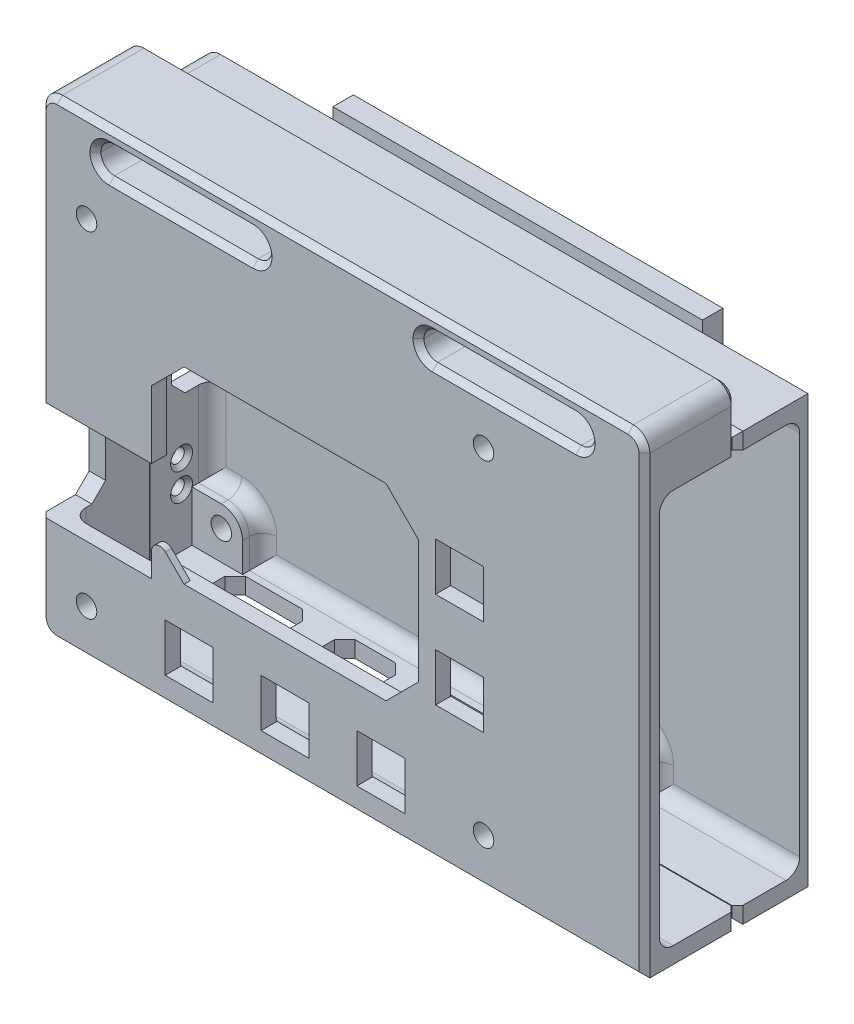
from build123d import *

# Parameters (mm, degrees)
BOSS_EXTRUDE1_DEPTH      = 13.1275
BOSS_EXTRUDE2_DEPTH      = 0.4
BOSS_EXTRUDE2_DEPTH_BACK = 1.8
CUT_EXTRUDE1_DEPTH       = 105.17063693767074
CUT_EXTRUDE2_DEPTH       = 1.3
SKETCH15_W               = 39
SKETCH15_H               = 3.999999999999993
SKETCH15_W_2             = 11
SKETCH15_H_2             = 4
CUT_EXTRUDE8_DEPTH       = 1
SKETCH5_R                = 1.500000000000004
SKETCH5_R_2              = 1.5000000000000002
SKETCH5_R_3              = 1.5000000000000004
SKETCH5_R_4              = 1.5000000000000042
BOSS_EXTRUDE3_DEPTH      = 2.8875
SKETCH17_R               = 1.5000000000000007
SKETCH17_R_2             = 1.5000000000000009
SKETCH17_R_3             = 1.5000000000000109
SKETCH17_R_4             = 1.500000000000004
CUT_EXTRUDE9_DEPTH       = 105.20149833975519
SKETCH6_W                = 7.000000000000007
SKETCH6_H                = 7
SKETCH6_W_2              = 7
SKETCH6_H_2              = 6.999999999999999
CUT_EXTRUDE3_DEPTH       = 105.46354989301294
CUT_EXTRUDE4_DEPTH       = 7.0875
BOSS_EXTRUDE4_DEPTH      = 9.16
SKETCH9_R                = 1.5000000000000009
SKETCH9_R_2              = 1.5000000000000109
SKETCH9_R_3              = 1.500000000000004
SKETCH9_R_4              = 1.5000000000000007
BOSS_EXTRUDE5_DEPTH      = 2
SKETCH10_R               = 1.5000000000000044
SKETCH10_R_2             = 1.5000000000000007
SKETCH10_R_3             = 1.5000000000000042
SKETCH10_R_4             = 1.5000000000000018
BOSS_EXTRUDE6_DEPTH      = 3
SKETCH11_W               = 8.846984852238524
SKETCH11_H               = 17.999999999999996
CUT_EXTRUDE5_DEPTH       = 8
CUT_EXTRUDE6_DEPTH       = 2.4
CHAMFER1_SIZE            = 1.5
FILLET1_R                = 2
FILLET2_R                = 2
CUT_EXTRUDE7_DEPTH       = 108.08866726339443
BOSS_EXTRUDE7_DEPTH      = 13.4775
SKETCH21_R               = 1.000000000000001
SKETCH21_R_2             = 1.0000000000000004
CUT_EXTRUDE11_DEPTH      = 4
CHAMFER10_SIZE           = 0.6
CHAMFER7_SIZE            = 0.8
FILLET3_R                = 2
FILLET4_R                = 2.4
FILLET5_R                = 2.4
CHAMFER2_SIZE            = 0.8
CHAMFER3_SIZE            = 0.8
FILLET6_R                = 1.2
CHAMFER5_SIZE            = 2
CHAMFER6_SIZE            = 2
SKETCH18_W               = 54.00000000000004
SKETCH18_H               = 64.00000000000001
BOSS_EXTRUDE8_DEPTH      = 3
SKETCH20_R               = 1.3000000000000023
SKETCH20_R_2             = 1.3000000000000016
SKETCH20_R_3             = 3.9999999999999982
CUT_EXTRUDE10_DEPTH      = 111.8826300925894
CHAMFER8_SIZE            = 0.8
CHAMFER9_SIZE            = 0.8
FILLET7_R                = 3


# Some blends are built 0.0001 mm under size
with BuildPart() as part:
    # Sketch2 → Boss-Extrude1 (new body)
    with BuildSketch(Plane.XY.offset(18.287499999999998)):
        Polygon((84.99999999999999, 56.800000000000004), (85.00000000000001, 59.2), (-3.200000000000008, 59.19999999999999), (-3.1999999999999895, -3.1999999999999877), (85.00000000000001, -3.199999999999939), (85, -0.7999999999999952), (-0.7999999999999813, -0.7999999999999883), (-0.7999999999999813, 56.8), align=None)
    extrude(amount=-BOSS_EXTRUDE1_DEPTH)

    # Sketch3 → Boss-Extrude2 (add, two sides: drawn at the far end of the back side and taken through both)
    with BuildSketch(Plane.XY.offset(18.287499999999998).offset(-BOSS_EXTRUDE2_DEPTH_BACK)):
        Polygon((85.00000000000001, -3.199999999999939), (-3.2000000000000006, -3.199999999999939), (-3.200000000000008, 59.19999999999999), (85.00000000000001, 59.2), align=None)
    extrude(amount=BOSS_EXTRUDE2_DEPTH + BOSS_EXTRUDE2_DEPTH_BACK)

    # Sketch1 → Cut-Extrude1 (cut, through all)
    with BuildSketch(Plane.XY.offset(16.200000000000003)):
        Polygon((13.000000000000007, 36.14999999999996), (17.750000000000046, 40.900000000000006), (47.249999999999986, 40.900000000000006), (52.00000000000003, 36.14999999999997), (52.00000000000003, 18.15000000000005), (47.249999999999986, 13.40000000000001), (17.750000000000046, 13.40000000000001), (13.000000000000005, 18.15000000000004), align=None)
    extrude(amount=CUT_EXTRUDE1_DEPTH, mode=Mode.SUBTRACT)

    # Sketch4 → Cut-Extrude2 (cut)
    with BuildSketch(Plane(origin=(0, 0, 16.487499999999997), x_dir=(-1, 0, 0), z_dir=(0, 0, -1))):
        Polygon((-13.000000000000009, 40.900000000000006), (-52.00000000000002, 40.900000000000006), (-52.00000000000003, 13.400000000000002), (-13.000000000000005, 13.400000000000002), align=None)
    extrude(amount=-CUT_EXTRUDE2_DEPTH, mode=Mode.SUBTRACT)

    # Sketch15 → Cut-Extrude8 (cut)
    with BuildSketch(Plane(origin=(0, 0, 16.487499999999997), x_dir=(-1, 0, 0), z_dir=(0, 0, -1))):
        with Locations((-32.50000000000001, 47.89999999999995)):
            Rectangle(SKETCH15_W, SKETCH15_H)
        with Locations((-46.50000000000001, 10.099999999999937)):
            Rectangle(SKETCH15_W_2, SKETCH15_H_2)
        Polygon((-24.000000000000004, 12.099999999999937), (-13.00000000000001, 12.099999999999989), (-13.00000000000001, 8.099999999999937), (-24.000000000000004, 8.099999999999941), align=None)
    extrude(amount=-CUT_EXTRUDE8_DEPTH, mode=Mode.SUBTRACT)

    # Sketch5 → Boss-Extrude3 (add)
    # profile 1 of 4: a face of its own
    with BuildSketch(Plane(origin=(0, 0, 16.487499999999997), x_dir=(-1, 0, 0), z_dir=(0, 0, -1))):
        with BuildLine():
            Line((-52.815937956643374, -0.7999999999999952), (-64.6, -0.7999999999999967))
            Line((-64.6, -0.7999999999999967), (-64.59999999999998, 3.4999999999999614))
            ThreePointArc((-64.59999999999998, 3.4999999999999614), (-62.686318640331784, 6.3640265507849225), (-59.30796897832172, 5.692031021678271))
            Line((-59.30796897832172, 5.692031021678271), (-52.815937956643374, -0.7999999999999952))
        make_face()
        with Locations(Location((-61.50000000000001, 3.4999999999999614, 0), (0, 0, 90))):
            Circle(SKETCH5_R, mode=Mode.SUBTRACT)
    # profile 2 of 4: a face of its own
    with BuildSketch(Plane(origin=(0, 0, 16.487499999999997), x_dir=(-1, 0, 0), z_dir=(0, 0, -1))):
        with BuildLine():
            Line((-6.599999999999987, 3.499999999999961), (-6.599999999999987, -0.7999999999999952))
            Line((-6.599999999999987, -0.7999999999999952), (0.7999999999999813, -0.7999999999999883))
            Line((0.7999999999999813, -0.7999999999999883), (0.7999999999999803, 6.599999999999961))
            Line((0.7999999999999803, 6.599999999999961), (-3.4999999999999893, 6.599999999999961))
            ThreePointArc((-3.4999999999999893, 6.599999999999961), (-5.692031021678284, 5.692031021678252), (-6.599999999999987, 3.499999999999961))
        make_face()
        with Locations(Location((-3.500000000000003, 3.4999999999999614, 0), (0, 0, 90))):
            Circle(SKETCH5_R_2, mode=Mode.SUBTRACT)
    # profile 3 of 4: a face of its own
    with BuildSketch(Plane(origin=(0, 0, 16.487499999999997), x_dir=(-1, 0, 0), z_dir=(0, 0, -1))):
        with BuildLine():
            Line((0.7999999999999803, 49.39999999999996), (0.7999999999999813, 56.79999999999991))
            Line((0.7999999999999813, 56.79999999999991), (-6.599999999999987, 56.79999999999992))
            Line((-6.599999999999987, 56.79999999999992), (-6.599999999999987, 52.499999999999964))
            ThreePointArc((-6.599999999999987, 52.499999999999964), (-5.692031021678284, 50.307968978321675), (-3.4999999999999893, 49.39999999999996))
            Line((-3.4999999999999893, 49.39999999999996), (0.7999999999999803, 49.39999999999996))
        make_face()
        with Locations(Location((-3.500000000000003, 52.499999999999964, 0), (0, 0, 180))):
            Circle(SKETCH5_R_3, mode=Mode.SUBTRACT)
    # profile 4 of 4: a face of its own
    with BuildSketch(Plane(origin=(0, 0, 16.487499999999997), x_dir=(-1, 0, 0), z_dir=(0, 0, -1))):
        with BuildLine():
            Line((-59.30796897832171, 50.307968978321654), (-52.815937956643374, 56.79999999999992))
            Line((-52.815937956643374, 56.79999999999992), (-64.6, 56.79999999999992))
            Line((-64.6, 56.79999999999992), (-64.59999999999998, 52.499999999999964))
            ThreePointArc((-64.59999999999998, 52.499999999999964), (-62.68631864033178, 49.635973449215), (-59.30796897832171, 50.307968978321654))
        make_face()
        with Locations(Location((-61.50000000000001, 52.499999999999964, 0), (0, 0, 180))):
            Circle(SKETCH5_R_4, mode=Mode.SUBTRACT)
    extrude(amount=BOSS_EXTRUDE3_DEPTH)

    # Sketch17 → Cut-Extrude9 (cut, through all)
    with BuildSketch(Plane(origin=(0, 0, 16.487499999999997), x_dir=(-1, 0, 0), z_dir=(0, 0, -1))):
        with Locations(Location((-3.500000000000003, 3.4999999999999614, 0), (0, 0, 90))):
            Circle(SKETCH17_R)
        with Locations(Location((-3.500000000000003, 52.499999999999964, 0), (0, 0, 90))):
            Circle(SKETCH17_R_2)
        with Locations(Location((-61.50000000000001, 52.499999999999964, 0), (0, 0, 90))):
            Circle(SKETCH17_R_3)
        with Locations(Location((-61.50000000000001, 3.4999999999999614, 0), (0, 0, 90))):
            Circle(SKETCH17_R_4)
    extrude(amount=-CUT_EXTRUDE9_DEPTH, mode=Mode.SUBTRACT)

    # Sketch6 → Cut-Extrude3 (cut, through all)
    with BuildSketch(Plane.XY.offset(18.6875)):
        with Locations((58.000000000000014, 19.999999999999957)):
            Rectangle(SKETCH6_W, SKETCH6_H)
        with Locations((58.00000000000001, 33.99999999999996)):
            Rectangle(SKETCH6_W_2, SKETCH6_H)
        with Locations((18.50000000000001, 3.999999999999955)):
            Rectangle(SKETCH6_W_2, SKETCH6_H_2)
        with Locations((46.5, 3.999999999999955)):
            Rectangle(SKETCH6_W, SKETCH6_H_2)
        with Locations((32.500000000000014, 3.999999999999955)):
            Rectangle(SKETCH6_W, SKETCH6_H_2)
    extrude(amount=-CUT_EXTRUDE3_DEPTH, mode=Mode.SUBTRACT)

    # Sketch7 → Cut-Extrude4 (cut)
    with BuildSketch(Plane.XY.offset(18.6875)):
        Polygon((-3.200000000000005, 11.71499999999995), (12.999999999999998, 11.714999999999952), (12.999999999999998, 26.284999999999958), (-3.200000000000008, 26.284999999999954), align=None)
    extrude(amount=-CUT_EXTRUDE4_DEPTH, mode=Mode.SUBTRACT)


with BuildPart() as body_2:
    # Sketch8 → Boss-Extrude4 (new body)
    with BuildSketch(Plane(origin=(0, 0, 5.159999999999999), x_dir=(-1, 0, 0), z_dir=(0, 0, -1))):
        Polygon((-85.00000000000001, 59.2), (-84.99999999999999, 56.800000000000004), (0.7999999999999813, 56.8), (0.7999999999999813, -0.7999999999999883), (-85, -0.7999999999999952), (-85.00000000000001, -3.199999999999939), (3.1999999999999895, -3.1999999999999877), (3.200000000000008, 59.19999999999999), align=None)
    extrude(amount=BOSS_EXTRUDE4_DEPTH)

    # Sketch9 → Boss-Extrude5 (add)
    with BuildSketch(Plane(origin=(0, 0, -4), x_dir=(-1, 0, 0), z_dir=(0, 0, -1))):
        Polygon((-85.00000000000001, -3.199999999999939), (3.2000000000000006, -3.199999999999939), (3.200000000000008, 59.19999999999999), (-85.00000000000001, 59.2), align=None)
        with Locations((-3.500000000000003, 52.499999999999964)):
            Circle(SKETCH9_R, mode=Mode.SUBTRACT)
        with Locations((-61.50000000000001, 52.499999999999964)):
            Circle(SKETCH9_R_2, mode=Mode.SUBTRACT)
        with Locations((-61.50000000000001, 3.4999999999999614)):
            Circle(SKETCH9_R_3, mode=Mode.SUBTRACT)
        with Locations((-3.500000000000003, 3.4999999999999614)):
            Circle(SKETCH9_R_4, mode=Mode.SUBTRACT)
    extrude(amount=BOSS_EXTRUDE5_DEPTH)

    # Sketch10 → Boss-Extrude6 (add)
    # profile 1 of 4: a face of its own
    with BuildSketch(Plane.XY.offset(-4)):
        with BuildLine():
            Line((52.815937956643374, -0.7999999999999952), (64.6, -0.7999999999999967))
            Line((64.6, -0.7999999999999967), (64.59999999999998, 3.4999999999999614))
            ThreePointArc((64.59999999999998, 3.4999999999999614), (62.686318640331784, 6.364026550784922), (59.30796897832174, 5.692031021678257))
            Line((59.30796897832174, 5.692031021678257), (52.815937956643374, -0.7999999999999952))
        make_face()
        with Locations((61.50000000000001, 3.4999999999999614)):
            Circle(SKETCH10_R, mode=Mode.SUBTRACT)
    # profile 2 of 4: a face of its own
    with BuildSketch(Plane.XY.offset(-4)):
        with BuildLine():
            Line((-0.7999999999999813, -0.7999999999999883), (6.599999999999987, -0.7999999999999952))
            Line((6.599999999999987, -0.7999999999999952), (6.599999999999998, 3.4999999999999614))
            ThreePointArc((6.599999999999998, 3.4999999999999614), (5.692031021678292, 5.69203102167826), (3.49999999999999, 6.599999999999957))
            Line((3.49999999999999, 6.599999999999957), (-0.7999999999999803, 6.599999999999961))
            Line((-0.7999999999999803, 6.599999999999961), (-0.7999999999999813, -0.7999999999999883))
        make_face()
        with Locations((3.500000000000003, 3.4999999999999614)):
            Circle(SKETCH10_R_2, mode=Mode.SUBTRACT)
    # profile 3 of 4: a face of its own
    with BuildSketch(Plane.XY.offset(-4)):
        with BuildLine():
            Line((52.815937956643374, 56.79999999999992), (59.30796897832171, 50.307968978321654))
            ThreePointArc((59.30796897832171, 50.307968978321654), (62.68631864033179, 49.63597344921497), (64.59999999999998, 52.499999999999964))
            Line((64.59999999999998, 52.499999999999964), (64.6, 56.79999999999992))
            Line((64.6, 56.79999999999992), (52.815937956643374, 56.79999999999992))
        make_face()
        with Locations((61.50000000000001, 52.499999999999964)):
            Circle(SKETCH10_R_3, mode=Mode.SUBTRACT)
    # profile 4 of 4: a face of its own
    with BuildSketch(Plane.XY.offset(-4)):
        with BuildLine():
            Line((-0.7999999999999813, 56.79999999999991), (-0.7999999999999803, 49.39999999999996))
            Line((-0.7999999999999803, 49.39999999999996), (3.499999999999989, 49.39999999999998))
            ThreePointArc((3.499999999999989, 49.39999999999998), (5.692031021678286, 50.30796897832167), (6.599999999999987, 52.499999999999964))
            Line((6.599999999999987, 52.499999999999964), (6.599999999999987, 56.79999999999992))
            Line((6.599999999999987, 56.79999999999992), (-0.7999999999999813, 56.79999999999991))
        make_face()
        with Locations((3.500000000000003, 52.499999999999964)):
            Circle(SKETCH10_R_4, mode=Mode.SUBTRACT)
    extrude(amount=BOSS_EXTRUDE6_DEPTH)

    # Sketch11 → Cut-Extrude5 (cut)
    with BuildSketch(Plane(origin=(0, 0, -6), x_dir=(-1, 0, 0), z_dir=(0, 0, -1))):
        with Locations((-1.2234924261192555, 28.000000000000036)):
            Rectangle(SKETCH11_W, SKETCH11_H)
    extrude(amount=-CUT_EXTRUDE5_DEPTH, mode=Mode.SUBTRACT)


with BuildPart() as cut_extrude6_tool:
    # Sketch12 → Cut-Extrude6 (new body)
    with BuildSketch(Plane.XZ.offset(3.199999999999986)):
        with BuildLine():
            Line((49.99999999999999, 2.9), (49.99999999999999, 5.159999999999998))
            Line((49.99999999999999, 5.159999999999998), (50.69963638366921, 5.159999999999998))
            ThreePointArc((50.69963638366921, 5.159999999999998), (54, 6.900000000000002), (57.300363616330785, 5.159999999999998))
            Line((57.300363616330785, 5.159999999999998), (58, 5.159999999999998))
            Line((58, 5.159999999999998), (58, 2.9))
            ThreePointArc((58, 2.9), (54, -1.100000000000009), (49.99999999999999, 2.9))
        make_face()
        Polygon((21.55, -1), (30.469999782791994, -0.9999999999999989), (30.469999782791994, 5.159999999999997), (21.55, 5.159999999999996), align=None)
        Polygon((35.050000000000004, -1), (43.969999782792, -0.9999999999999989), (43.969999782792, 5.159999999999997), (35.050000000000004, 5.159999999999996), align=None)
        Polygon((5.530000000000009, -1.0000000000000013), (16.87, -1), (16.87, 5.159999999999998), (5.530000000000007, 5.159999999999997), align=None)
    extrude(amount=-CUT_EXTRUDE6_DEPTH)


with BuildPart() as part_1:
    add(part.part)

    # Cut-Extrude6: cut by cut_extrude6_tool
    add(cut_extrude6_tool.part, mode=Mode.SUBTRACT)

    # Fillet2
    # the kernel refuses this fillet: 2 mm, written as the material it adds along each edge
    with BuildSketch(Plane(origin=(64.6, 56.79999999999992, 16.487499999999997), x_dir=(0, 0, -1), z_dir=(-3.3e-15, -1, 0))) as fillet2_piece_1:
        with BuildLine():
            CenterArc((FILLET2_R, FILLET2_R), FILLET2_R, 180, 90)
            Line((0, FILLET2_R), (0, 0))
            Line((0, 0), (FILLET2_R, 0))
        make_face()
    extrude(amount=4.2999999999999545)
    with BuildSketch(Plane(origin=(59.30796897832171, 50.307968978321654, 16.487499999999997), x_dir=(0, 0, -1), z_dir=(-0.7071067811865515, 0.7071067811865437, 0))) as fillet2_piece_2_section:
        with BuildLine():
            CenterArc((FILLET2_R, FILLET2_R), FILLET2_R, 180.00000000000014, 89.99999999999989)
            Line((0, FILLET2_R), (0, 0))
            Line((0, 0), (FILLET2_R, 0))
        make_face()
    fillet2_piece_2 = extrude(amount=14.181118318204316, mode=Mode.PRIVATE)
    fillet2_piece_2 = split(fillet2_piece_2, bisect_by=Plane(origin=(55.57262538274945, 56.800000000000004, 16.049357236234062), z_dir=(8e-17, -1, 0)), keep=Keep.TOP, mode=Mode.PRIVATE)
    add(fillet2_piece_2)
    with BuildSketch(Plane(origin=(6.599999999999987, 56.79999999999992, 16.487499999999997), x_dir=(0, 0, -1), z_dir=(0, -1, 0))) as fillet2_piece_3:
        with BuildLine():
            CenterArc((FILLET2_R, FILLET2_R), FILLET2_R, 180, 90)
            Line((0, FILLET2_R), (0, 0))
            Line((0, 0), (FILLET2_R, 0))
        make_face()
    extrude(amount=4.2999999999999545)
    with BuildSketch(Plane(origin=(3.4999999999999893, 49.39999999999996, 16.487499999999997), x_dir=(0, 0, -1), z_dir=(-1, 0, 0))) as fillet2_piece_4:
        with BuildLine():
            CenterArc((FILLET2_R, FILLET2_R), FILLET2_R, 180, 90)
            Line((0, FILLET2_R), (0, 0))
            Line((0, 0), (FILLET2_R, 0))
        make_face()
    extrude(amount=4.29999999999997)
    with BuildSketch(Plane(origin=(-0.7999999999999803, 6.599999999999961, 16.487499999999997), x_dir=(0, 0, -1), z_dir=(1, 0, 0))) as fillet2_piece_5:
        with BuildLine():
            CenterArc((FILLET2_R, FILLET2_R), FILLET2_R, 179.99999999999994, 90.00000000000006)
            Line((0, FILLET2_R), (0, 0))
            Line((0, 0), (FILLET2_R, 0))
        make_face()
    extrude(amount=4.29999999999997)
    with BuildSketch(Plane(origin=(6.599999999999987, 3.499999999999961, 16.487499999999997), x_dir=(0, 0, -1), z_dir=(0, -1, 0))) as fillet2_piece_6_section:
        with BuildLine():
            CenterArc((FILLET2_R, FILLET2_R), FILLET2_R, 180, 90)
            Line((0, FILLET2_R), (0, 0))
            Line((0, 0), (FILLET2_R, 0))
        make_face()
    fillet2_piece_6 = extrude(amount=9.299999999999956, mode=Mode.PRIVATE)
    fillet2_piece_6 = split(fillet2_piece_6, bisect_by=Plane(origin=(7.046735877891493, -3.199999999999939, 16.04076412210849), z_dir=(0, 1, 0)), keep=Keep.TOP, mode=Mode.PRIVATE)
    add(fillet2_piece_6)
    with BuildSketch(Plane(origin=(59.30796897832172, 5.692031021678271, 16.487499999999997), x_dir=(-0.7071067811865434, 0.7071067811865518, 0), z_dir=(-0.7071067811865517, -0.7071067811865434, 0))) as fillet2_piece_7_section:
        with BuildLine():
            CenterArc((FILLET2_R, FILLET2_R), FILLET2_R, 180, 90)
            Line((-6.3e-16, FILLET2_R), (0, 0))
            Line((0, 0), (FILLET2_R, 0))
        make_face()
    fillet2_piece_7 = extrude(amount=14.18111831820432, mode=Mode.PRIVATE)
    fillet2_piece_7 = split(fillet2_piece_7, bisect_by=Plane(origin=(55.57262538274922, -3.199999999999939, 16.04935723623407), z_dir=(0, 1, 0)), keep=Keep.TOP, mode=Mode.PRIVATE)
    add(fillet2_piece_7)
    with BuildSketch(Plane(origin=(64.60000000000001, -5.800000000000001, 16.487499999999997), x_dir=(1, 3.3e-15, 0), z_dir=(-3.3e-15, 1, 0))) as fillet2_piece_8_section:
        with BuildLine():
            CenterArc((FILLET2_R, FILLET2_R), FILLET2_R, 180, 90)
            Line((0, FILLET2_R), (0, 0))
            Line((0, 0), (FILLET2_R, 0))
        make_face()
    fillet2_piece_8 = extrude(amount=9.299999999999958, mode=Mode.PRIVATE)
    fillet2_piece_8 = split(fillet2_piece_8, bisect_by=Plane(origin=(65.0467358778915, -3.199999999999939, 16.040764122108495), z_dir=(0, 1, 0)), keep=Keep.TOP, mode=Mode.PRIVATE)
    add(fillet2_piece_8)
    with BuildSketch(Plane(origin=(1.5999999999999872, 56.8, 16.487499999999997), x_dir=(0, 0, -1), z_dir=(1, 8e-17, 0))) as fillet2_piece_9:
        with BuildLine():
            CenterArc((FILLET2_R, -FILLET2_R), FILLET2_R, 90, 90)
            Line((0, -FILLET2_R), (0, 0))
            Line((0, 0), (FILLET2_R, 0))
        make_face()
    extrude(amount=56.21593795664339)
    with BuildSketch(Plane(origin=(59.599999999999994, 56.800000000000004, 16.487499999999997), x_dir=(0, 0, -1), z_dir=(1, 8e-17, 0))) as fillet2_piece_10:
        with BuildLine():
            CenterArc((FILLET2_R, -FILLET2_R), FILLET2_R, 90, 90)
            Line((0, -FILLET2_R), (0, 0))
            Line((0, 0), (FILLET2_R, 0))
        make_face()
    extrude(amount=25.39999999999999)
    with BuildSketch(Plane(origin=(61.49999999999998, 52.49999999999998, 16.487499999999997), x_dir=(1, -4.58e-15, 0), z_dir=(4.58e-15, 1, 0))) as fillet2_piece_11:
        with BuildLine():
            CenterArc((3.1000000000000014 + FILLET2_R, FILLET2_R), FILLET2_R, 180, 90)
            Line((3.1000000000000014 + FILLET2_R, 0), (3.1000000000000014, 0))
            Line((3.1000000000000014, 0), (3.1000000000000014, FILLET2_R))
        make_face()
    revolve(axis=Axis((61.49999999999998, 52.49999999999998, 16.487499999999997), (0, 0, -1)), revolution_arc=134.999999999999)
    with BuildSketch(Plane(origin=(3.4999999999999725, 52.49999999999998, 16.487499999999997), x_dir=(1, -4.58e-15, 0), z_dir=(4.58e-15, 1, 0))) as fillet2_piece_12:
        with BuildLine():
            CenterArc((3.1000000000000147 + FILLET2_R, FILLET2_R), FILLET2_R, 180, 90)
            Line((3.1000000000000147 + FILLET2_R, 0), (3.1000000000000147, 0))
            Line((3.1000000000000147, 0), (3.1000000000000147, FILLET2_R))
        make_face()
    revolve(axis=Axis((3.4999999999999725, 52.49999999999998, 16.487499999999997), (0, 0, -1)), revolution_arc=89.99999999999943)
    with BuildSketch(Plane(origin=(-0.7999999999999821, 26.284999999999954, 16.487499999999997), x_dir=(4.4e-16, 0, -1), z_dir=(0, 1, 0))) as fillet2_piece_13:
        with BuildLine():
            CenterArc((FILLET2_R, -FILLET2_R), FILLET2_R, 90.00000000000003, 89.99999999999994)
            Line((8.9e-16, -FILLET2_R), (0, 0))
            Line((0, 0), (FILLET2_R, 0))
        make_face()
    extrude(amount=28.11500000000001)
    with BuildSketch(Plane(origin=(-0.7999999999999813, 1.5999999999999606, 16.487499999999997), x_dir=(6e-17, 0, -1), z_dir=(0, 1, 0))) as fillet2_piece_14:
        with BuildLine():
            CenterArc((FILLET2_R, -FILLET2_R), FILLET2_R, 90, 89.99999999999994)
            Line((1.1e-16, -FILLET2_R), (0, 0))
            Line((0, 0), (FILLET2_R, 0))
        make_face()
    extrude(amount=10.11499999999999)
    with BuildSketch(Plane(origin=(3.4999999999999774, 3.4999999999999507, 16.487499999999997), x_dir=(3.87e-15, 1, 0), z_dir=(-1, 3.87e-15, 0))) as fillet2_piece_15:
        with BuildLine():
            CenterArc((3.10000000000001 + FILLET2_R, FILLET2_R), FILLET2_R, 180, 90.00000000000006)
            Line((3.10000000000001 + FILLET2_R, 0), (3.10000000000001, 0))
            Line((3.10000000000001, 0), (3.10000000000001, FILLET2_R))
        make_face()
    revolve(axis=Axis((3.4999999999999774, 3.4999999999999507, 16.487499999999997), (0, 0, -1)), revolution_arc=89.99999999999959)
    with BuildSketch(Plane(origin=(85, -0.7999999999999962, 16.487499999999997), x_dir=(8e-17, 1, 0), z_dir=(-1, 8e-17, 0))) as fillet2_piece_16:
        with BuildLine():
            CenterArc((FILLET2_R, FILLET2_R), FILLET2_R, 180, 90)
            Line((-1e-15, FILLET2_R), (0, 0))
            Line((0, 0), (FILLET2_R, 0))
        make_face()
    extrude(amount=25.400000000000006)
    with BuildSketch(Plane(origin=(57.81593795664338, -0.7999999999999936, 16.487499999999997), x_dir=(8e-17, 1, 0), z_dir=(-1, 8e-17, 0))) as fillet2_piece_17_section:
        with BuildLine():
            CenterArc((FILLET2_R, FILLET2_R), FILLET2_R, 180, 90)
            Line((0, FILLET2_R), (0, 0))
            Line((0, 0), (FILLET2_R, 0))
        make_face()
    fillet2_piece_17 = extrude(amount=56.21593795664339, mode=Mode.PRIVATE)
    fillet2_piece_17 = split(fillet2_piece_17, bisect_by=Plane(origin=(50.00000000000001, 0.6781341143220752, 16.450279888444182), z_dir=(1, 0, 0)), keep=Keep.TOP, mode=Mode.PRIVATE)
    add(fillet2_piece_17)
    with BuildSketch(Plane(origin=(57.81593795664338, -0.7999999999999936, 16.487499999999997), x_dir=(8e-17, 1, 0), z_dir=(-1, 8e-17, 0))) as fillet2_piece_18_section:
        with BuildLine():
            CenterArc((FILLET2_R, FILLET2_R), FILLET2_R, 180, 90)
            Line((0, FILLET2_R), (0, 0))
            Line((0, 0), (FILLET2_R, 0))
        make_face()
    fillet2_piece_18 = extrude(amount=56.21593795664339, mode=Mode.PRIVATE)
    fillet2_piece_18 = split(fillet2_piece_18, bisect_by=Plane(origin=(46.500000000000014, 0.49999999999995576, 16.026395634018595), z_dir=(0, -1, 0)), keep=Keep.TOP, mode=Mode.PRIVATE)
    add(fillet2_piece_18)
    with BuildSketch(Plane(origin=(57.81593795664338, -0.7999999999999936, 16.487499999999997), x_dir=(8e-17, 1, 0), z_dir=(-1, 8e-17, 0))) as fillet2_piece_19_section:
        with BuildLine():
            CenterArc((FILLET2_R, FILLET2_R), FILLET2_R, 180, 90)
            Line((0, FILLET2_R), (0, 0))
            Line((0, 0), (FILLET2_R, 0))
        make_face()
    fillet2_piece_19 = extrude(amount=56.21593795664339, mode=Mode.PRIVATE)
    fillet2_piece_19 = split(fillet2_piece_19, bisect_by=Plane(origin=(36.000000000000014, 0.673873982856904, 16.449764820682425), z_dir=(1, 0, 0)), keep=Keep.TOP, mode=Mode.PRIVATE)
    fillet2_piece_19 = split(fillet2_piece_19, bisect_by=Plane(origin=(43, 0.6738739828569038, 16.449764820682425), z_dir=(-1, 0, 0)), keep=Keep.TOP, mode=Mode.PRIVATE)
    add(fillet2_piece_19)
    with BuildSketch(Plane(origin=(57.81593795664338, -0.7999999999999936, 16.487499999999997), x_dir=(8e-17, 1, 0), z_dir=(-1, 8e-17, 0))) as fillet2_piece_20_section:
        with BuildLine():
            CenterArc((FILLET2_R, FILLET2_R), FILLET2_R, 180, 90)
            Line((0, FILLET2_R), (0, 0))
            Line((0, 0), (FILLET2_R, 0))
        make_face()
    fillet2_piece_20 = extrude(amount=56.21593795664339, mode=Mode.PRIVATE)
    fillet2_piece_20 = split(fillet2_piece_20, bisect_by=Plane(origin=(22.00000000000001, 0.6738739828569044, 16.44976482068242), z_dir=(1, 0, 0)), keep=Keep.TOP, mode=Mode.PRIVATE)
    fillet2_piece_20 = split(fillet2_piece_20, bisect_by=Plane(origin=(29.000000000000007, 0.6738739828569047, 16.44976482068242), z_dir=(-1, 0, 0)), keep=Keep.TOP, mode=Mode.PRIVATE)
    add(fillet2_piece_20)
    with BuildSketch(Plane(origin=(57.81593795664338, -0.7999999999999936, 16.487499999999997), x_dir=(8e-17, 1, 0), z_dir=(-1, 8e-17, 0))) as fillet2_piece_21_section:
        with BuildLine():
            CenterArc((FILLET2_R, FILLET2_R), FILLET2_R, 180, 90)
            Line((0, FILLET2_R), (0, 0))
            Line((0, 0), (FILLET2_R, 0))
        make_face()
    fillet2_piece_21 = extrude(amount=56.21593795664339, mode=Mode.PRIVATE)
    fillet2_piece_21 = split(fillet2_piece_21, bisect_by=Plane(origin=(15.00000000000001, 0.6738739828569029, 16.44976482068242), z_dir=(-1, 0, 0)), keep=Keep.TOP, mode=Mode.PRIVATE)
    add(fillet2_piece_21)
    with BuildSketch(Plane(origin=(61.499999999999986, 3.499999999999948, 16.487499999999997), x_dir=(1, 4.3e-15, 0), z_dir=(4.3e-15, -1, 0))) as fillet2_piece_22:
        with BuildLine():
            CenterArc((3.0999999999999943 + FILLET2_R, -FILLET2_R), FILLET2_R, 90, 90)
            Line((3.0999999999999943, -FILLET2_R), (3.0999999999999943, 0))
            Line((3.0999999999999943, 0), (3.0999999999999943 + FILLET2_R, 0))
        make_face()
    revolve(axis=Axis((61.499999999999986, 3.499999999999948, 16.487499999999997), (0, 0, 1)), revolution_arc=134.99999999999906)


with BuildPart() as body_2_1:
    add(body_2.part)

    # Cut-Extrude6: cut by cut_extrude6_tool
    add(cut_extrude6_tool.part, mode=Mode.SUBTRACT)

    # Chamfer1
    # the kernel refuses this chamfer: 1.5 mm, written as the material it adds along each edge
    with BuildSketch(Plane(origin=(30.469999782791994, -3.199999999999969, -0.9999999999999989), x_dir=(0.027495876610586778, 0, 0.9996219169112968), z_dir=(-5.5e-16, 1, 0)), Plane(origin=(43.969999782792, -3.1999999999999615, -0.9999999999999989), x_dir=(0.027495876610586778, 0, 0.9996219169112968), z_dir=(-5.5e-16, 1, 0)), Plane(origin=(16.87, -3.1999999999999766, -1), x_dir=(0.027495876610586778, 0, 0.9996219169112968), z_dir=(-5.5e-16, 1, 0))) as chamfer1_piece_1:
        Polygon((CHAMFER1_SIZE * 0.999621916911, -CHAMFER1_SIZE * 0.0274958766106), (-CHAMFER1_SIZE * 0.0274958766106, -CHAMFER1_SIZE * 0.999621916911), (0, 0), align=None)
    extrude(amount=2.4)
    with BuildSketch(Plane(origin=(21.55, -3.199999999999974, -1), x_dir=(0.9996219169112968, 0, -0.02749587661058619), z_dir=(-5.5e-16, 1, 0)), Plane(origin=(35.050000000000004, -3.199999999999967, -1), x_dir=(0.9996219169112968, 0, -0.02749587661058619), z_dir=(-5.5e-16, 1, 0))) as chamfer1_piece_2:
        Polygon((CHAMFER1_SIZE * 0.999621916911, -CHAMFER1_SIZE * 0.0274958766106), (-CHAMFER1_SIZE * 0.0274958766106, -CHAMFER1_SIZE * 0.999621916911), (0, 0), align=None)
    extrude(amount=2.4)
    with BuildSketch(Plane(origin=(5.530000000000011, -3.199999999999983, -1.0000000000000013), x_dir=(0.9996219169112969, 0, -0.02749587661058621), z_dir=(-5.5e-16, 1, 0))) as chamfer1_piece_3:
        Polygon((CHAMFER1_SIZE * 0.999621916911, -CHAMFER1_SIZE * 0.0274958766106), (-CHAMFER1_SIZE * 0.0274958766106, -CHAMFER1_SIZE * 0.999621916911), (0, 0), align=None)
    extrude(amount=2.4)

    # Fillet1
    fillet1_edges = [body_2_1.edges().sort_by_distance(p)[0] for p in [
        (29.707968978321674, 56.8, -4.000000000000001),
        (6.599999999999987, 54.64999999999994, -4),
        (5.692031021678288, 50.30796897832167, -4),
        (1.350000000000004, 49.39999999999997, -4),
        (-0.7999999999999813, 43.2, -4.000000000000001),
        (74.8, -0.7999999999999944, -4.000000000000001),
        (29.70796897832168, -0.7999999999999907, -4.000000000000001),
        (62.686318640331784, 6.364026550784923, -4),
        (64.6, 1.3499999999999823, -4),
        (56.06195346748255, 2.4460155108391306, -4),
        (-0.7999999999999813, 12.799999999999997, -4.000000000000001),
        (1.3500000000000045, 6.599999999999959, -4),
        (5.692031021678293, 5.692031021678261, -4),
        (6.5999999999999925, 1.349999999999983, -4),
        (74.79999999999998, 56.800000000000004, -4.000000000000001),
        (56.061953467482546, 53.55398448916078, -4),
        (64.6, 54.64999999999994, -4),
        (62.686318640331784, 49.635973449214966, -4),
    ]]
    fillet(fillet1_edges, radius=FILLET1_R)


with BuildPart() as cut_extrude7_tool:
    # Sketch14 → Cut-Extrude7 (new, through all)
    with BuildSketch(Plane(origin=(-9.31e-15, 59.19999999999999, 0), x_dir=(1, 1.6e-16, 0), z_dir=(-1.6e-16, 1, 0))):
        Polygon((85.00000000000004, -5.109999999999979), (-3.200000000000008, -5.109999999999979), (-3.1999999999999993, -5.209999999999999), (85.00000000000004, -5.209999999999999), align=None)
    extrude(amount=-CUT_EXTRUDE7_DEPTH)


with BuildPart() as part_2:
    add(part_1.part)

    # Cut-Extrude7: cut by cut_extrude7_tool
    add(cut_extrude7_tool.part, mode=Mode.SUBTRACT)

    # Sketch16 → Boss-Extrude7 (add)
    with BuildSketch(Plane.XY.offset(18.6875)):
        Polygon((4.799999999999992, 59.19999999999999), (-3.200000000000008, 59.19999999999999), (-3.1999999999999926, 65.6), (85.00000000000001, 65.6), (85.00000000000001, 59.2), (77.00000000000003, 59.199999999999996), (77.00000000000003, 63.2), (52.000000000000085, 63.2), (52.000000000000085, 59.19999999999999), (29.8, 59.19999999999999), (29.8, 63.2), (4.799999999999992, 63.2), align=None)
    extrude(amount=-BOSS_EXTRUDE7_DEPTH)

    # Chamfer7
    chamfer7_edges = [part_2.edges().sort_by_distance(p)[0] for p in [
        (40.900000000000006, 65.6, 5.210000000000001),
    ]]
    chamfer(chamfer7_edges, length=CHAMFER7_SIZE)

    # Fillet3
    fillet3_edges = [part_2.edges().sort_by_distance(p)[0] for p in [
        (77.00000000000003, 59.199999999999996, 11.94875),
        (77.00000000000003, 63.2, 11.94875),
        (52.000000000000085, 63.2, 11.94875),
        (52.000000000000085, 59.19999999999999, 11.94875),
        (4.799999999999992, 59.19999999999999, 11.94875),
        (29.8, 59.19999999999999, 11.94875),
        (29.8, 63.2, 11.94875),
        (4.799999999999992, 63.2, 11.94875),
    ]]
    fillet(fillet3_edges, radius=FILLET3_R - 0.0001)  # a hair under: the kernel refuses the full size

    # Fillet4
    fillet4_edges = [part_2.edges().sort_by_distance(p)[0] for p in [
        (-3.1999999999999953, -3.1999999999999633, 11.948749999999997),
        (-3.1999999999999926, 65.6, 12.348749999999999),
        (85.00000000000001, 65.6, 12.348749999999999),
    ]]
    fillet(fillet4_edges, radius=FILLET4_R)

    # Chamfer2
    chamfer2_edges = [part_2.edges().sort_by_distance(p)[0] for p in [
        (-3.2000000000000015, 5.457499999999975, 18.687499999999996),
        (85.00000000000001, 30.000000000000036, 18.687499999999996),
        (64.50000000000006, 59.2, 18.687499999999996),
        (64.50000000000006, 63.2, 18.6875),
        (17.299999999999997, 59.19999999999999, 18.687499999999996),
        (17.299999999999997, 63.2, 18.6875),
        (76.41424285169501, 59.785757148305024, 18.687499999999996),
        (76.41424285169501, 62.61424285169498, 18.687499999999996),
        (52.585757148305106, 62.61424285169498, 18.687499999999996),
        (52.585757148305106, 59.785757148305024, 18.687499999999996),
        (5.3857571483050215, 59.78575714830502, 18.687499999999996),
        (29.214242851694976, 59.78575714830502, 18.687499999999996),
        (29.214242851694976, 62.61424285169498, 18.687499999999996),
        (5.385757148305016, 62.61424285169498, 18.687499999999996),
        (-3.200000000000001, 44.74249999999998, 18.6875),
        (40.899999999999984, 65.6, 18.6875),
        (42.100000000000016, -3.199999999999939, 18.687499999999996),
        (84.2970562748477, 64.8970562748477, 18.687499999999996),
        (-2.4970562748477265, 64.8970562748477, 18.687499999999996),
        (-2.497056274847702, -2.4970562748477168, 18.6875),
    ]]
    chamfer(chamfer2_edges, length=CHAMFER2_SIZE)

    # Fillet6
    fillet6_edges = [part_2.edges().sort_by_distance(p)[0] for p in [
        (13.000000000000005, 18.149999999999984, 18.237499999999997),
    ]]
    fillet(fillet6_edges, radius=FILLET6_R)

    # Chamfer6
    chamfer6_edges = [part_2.edges().sort_by_distance(p)[0] for p in [
        (-1.9999999999999947, 26.284999999999954, 11.6),
        (-1.9999999999999931, 11.71499999999995, 11.6),
    ]]
    chamfer(chamfer6_edges, length=CHAMFER6_SIZE)

    # Chamfer8
    chamfer8_edges = [part_2.edges().sort_by_distance(p)[0] for p in [
        (84.84201366151053, 64.05637301545535, 5.209999999999999),
        (85, 60, 5.21),
        (-3.0420136615106013, 64.05637301545522, 5.209999999999999),
        (-3.1999999999999935, 31.199999999999967, 5.21),
        (-2.497056274847691, -2.497056274847765, 5.2100000000000035),
        (24.967218630679547, -3.2000000000000015, 5.209999999999999),
        (85.00000000000004, -1.9999999999999716, 5.209999999999999),
        (71.13278136932047, -3.2000000000000015, 5.209999999999999),
    ]]
    chamfer(chamfer8_edges, length=CHAMFER8_SIZE - 0.0001)  # a hair under: the kernel refuses the full size


with BuildPart() as body_2_2:
    add(body_2_1.part)

    # Cut-Extrude7: cut by cut_extrude7_tool
    add(cut_extrude7_tool.part, mode=Mode.SUBTRACT)

    # Sketch21 → Cut-Extrude11 (cut)
    with BuildSketch(Plane.ZY.offset(3.19999999999999)):
        with Locations(Location((0.5, 10.999999999999998, 0), (0, 0, 270))):
            Circle(SKETCH21_R)
        with Locations(Location((0.5, 6.999999999999999, 0), (0, 0, 270))):
            Circle(SKETCH21_R_2)
    extrude(amount=-CUT_EXTRUDE11_DEPTH, mode=Mode.SUBTRACT)

    # Chamfer10
    # the kernel refuses this chamfer: 0.6 mm, written as the material it takes off along each edge
    with BuildSketch(Plane(origin=(-0.7999999999999812, 10.999999999999996, 0.5), x_dir=(3.3e-16, -1, -1.7e-16), z_dir=(0, 1.7e-16, -1))) as chamfer10_piece_1:
        Polygon((1.0000000000000018 + CHAMFER10_SIZE, 6.4e-16), (0.9999999999999998, CHAMFER10_SIZE), (1.0000000000000018, 0), align=None)
    revolve(axis=Axis((-0.7999999999999812, 10.999999999999996, 0.5), (-1, -3.1e-16, 0)), mode=Mode.SUBTRACT)
    with BuildSketch(Plane(origin=(-3.1999999999999935, 10.999999999999996, 0.5), x_dir=(4.4e-16, -1, -1.7e-16), z_dir=(0, 1.7e-16, -1))) as chamfer10_piece_2:
        Polygon((1.0000000000000002, -CHAMFER10_SIZE), (1.0000000000000018 + CHAMFER10_SIZE, 2.7e-16), (1.0000000000000018, 0), align=None)
    revolve(axis=Axis((-3.1999999999999935, 10.999999999999996, 0.5), (-1, -3.1e-16, 0)), mode=Mode.SUBTRACT)
    with BuildSketch(Plane(origin=(-0.7999999999999812, 6.999999999999999, 0.5), x_dir=(3.3e-16, -1, -1.7e-16), z_dir=(0, 1.7e-16, -1))) as chamfer10_piece_3_section:
        Polygon((1.0000000000000009 + CHAMFER10_SIZE, 6.4e-16), (1.0000000000000007, CHAMFER10_SIZE), (1.0000000000000009, 0), align=None)
    chamfer10_piece_3 = revolve(axis=Axis((-0.7999999999999812, 6.999999999999999, 0.5), (-1, -3.1e-16, 0)), mode=Mode.PRIVATE)
    chamfer10_piece_3 = split(chamfer10_piece_3, bisect_by=Plane(origin=(-1.0940913490509798, 5.978005263075614, -1), z_dir=(0, 0, 1)), keep=Keep.TOP, mode=Mode.PRIVATE)
    chamfer10_piece_3 = split(chamfer10_piece_3, bisect_by=Plane(origin=(-1.0940913490509794, 6.599999999999961, 1.293850853364468), z_dir=(-8.3e-16, -1, 0)), keep=Keep.TOP, mode=Mode.PRIVATE)
    add(chamfer10_piece_3, mode=Mode.SUBTRACT)
    with BuildSketch(Plane(origin=(-0.7999999999999812, 6.999999999999999, 0.5), x_dir=(3.3e-16, -1, -1.7e-16), z_dir=(0, 1.7e-16, -1))) as chamfer10_piece_4_section:
        Polygon((1.0000000000000009 + CHAMFER10_SIZE, 6.4e-16), (1.0000000000000007, CHAMFER10_SIZE), (1.0000000000000009, 0), align=None)
    chamfer10_piece_4 = revolve(axis=Axis((-0.7999999999999812, 6.999999999999999, 0.5), (-1, -3.1e-16, 0)), mode=Mode.PRIVATE)
    chamfer10_piece_4 = split(chamfer10_piece_4, bisect_by=Plane(origin=(-1.09316744027134, 8.29316744027136, -1), z_dir=(0, 0, 1)), keep=Keep.TOP, mode=Mode.PRIVATE)
    chamfer10_piece_4 = split(chamfer10_piece_4, bisect_by=Plane(origin=(-1.0931674402713418, 6.599999999999961, 0.5), z_dir=(8.3e-16, 1, 0)), keep=Keep.TOP, mode=Mode.PRIVATE)
    add(chamfer10_piece_4, mode=Mode.SUBTRACT)
    with BuildSketch(Plane(origin=(-0.7999999999999812, 6.999999999999999, 0.5), x_dir=(3.3e-16, -1, -1.7e-16), z_dir=(0, 1.7e-16, -1))) as chamfer10_piece_5_section:
        Polygon((1.0000000000000009 + CHAMFER10_SIZE, 6.4e-16), (1.0000000000000007, CHAMFER10_SIZE), (1.0000000000000009, 0), align=None)
    chamfer10_piece_5 = revolve(axis=Axis((-0.7999999999999812, 6.999999999999999, 0.5), (-1, -3.1e-16, 0)), mode=Mode.PRIVATE)
    chamfer10_piece_5 = split(chamfer10_piece_5, bisect_by=Plane(origin=(-0.8113477331760635, 7.021903840250857, -1), z_dir=(0, 0, -1)), keep=Keep.TOP, mode=Mode.PRIVATE)
    chamfer10_piece_5 = split(chamfer10_piece_5, bisect_by=Plane(origin=(-0.8113477331760639, 6.599999999999961, -1.0372616406184685), z_dir=(8.3e-16, 1, 0)), keep=Keep.TOP, mode=Mode.PRIVATE)
    add(chamfer10_piece_5, mode=Mode.SUBTRACT)
    with BuildSketch(Plane(origin=(-3.199999999999992, 6.999999999999998, 0.5), x_dir=(4.4e-16, -1, -1.7e-16), z_dir=(0, 1.7e-16, -1))) as chamfer10_piece_6:
        Polygon((1.0000000000000002, -CHAMFER10_SIZE), (1.0000000000000009 + CHAMFER10_SIZE, 7.1e-16), (1.0000000000000009, 0), align=None)
    revolve(axis=Axis((-3.199999999999992, 6.999999999999998, 0.5), (-1, -3.1e-16, 0)), mode=Mode.SUBTRACT)

    # Fillet5
    fillet5_edges = [body_2_2.edges().sort_by_distance(p)[0] for p in [
        (-3.200000000000008, 59.19999999999999, -0.44500000000001094),
        (-3.1999999999999953, -3.1999999999999633, -0.44500000000001094),
    ]]
    fillet(fillet5_edges, radius=FILLET5_R)

    # Chamfer3
    chamfer3_edges = [body_2_2.edges().sort_by_distance(p)[0] for p in [
        (-3.200000000000007, 46.90000000000001, -6),
        (-3.200000000000002, 9.10000000000002, -6),
        (85.00000000000001, 28.000000000000032, -6),
        (42.1, 59.199999999999996, -6),
        (-2.497056274847722, 58.4970562748477, -6),
        (-2.4970562748477074, -2.4970562748477123, -6.000000000000005),
        (42.10000000000001, -3.199999999999939, -6),
    ]]
    chamfer(chamfer3_edges, length=CHAMFER3_SIZE)

    # Chamfer5
    chamfer5_edges = [body_2_2.edges().sort_by_distance(p)[0] for p in [
        (-1.9999999999999938, 37.000000000000036, 2),
        (-1.999999999999994, 19.00000000000004, 2),
    ]]
    chamfer(chamfer5_edges, length=CHAMFER5_SIZE)

    # Chamfer9
    chamfer9_edges = [body_2_2.edges().sort_by_distance(p)[0] for p in [
        (85.00000000000004, -1.9999999999999716, 5.109999999999979),
        (85.00000000000003, 58, 5.109999999999979),
        (2.365000000000009, -3.2000000000000015, 5.109999999999979),
        (71.50000000000003, -3.2000000000000015, 5.109999999999979),
        (46.984999891396, -3.2000000000000015, 5.109999999999979),
        (32.759999891396, -3.2000000000000015, 5.109999999999979),
        (19.21, -3.2000000000000015, 5.109999999999979),
        (42.100000000000016, 59.199999999999996, 5.109999999999979),
        (-3.2000000000000126, 27.99999999999997, 5.109999999999979),
        (-2.497056274847722, 58.4970562748477, 5.109999999999979),
        (-2.4970562748476963, -2.4970562748477607, 5.109999999999973),
    ]]
    chamfer(chamfer9_edges, length=CHAMFER9_SIZE)

    # Fillet7
    fillet7_edges = [body_2_2.edges().sort_by_distance(p)[0] for p in [
        (5.646984852238518, 37.000000000000036, -5),
        (5.646984852238518, 19.00000000000004, -5),
    ]]
    fillet(fillet7_edges, radius=FILLET7_R)


with BuildPart() as body_3:
    # Sketch18 → Boss-Extrude8 (new body)
    with BuildSketch(Plane(origin=(0, 0, -6), x_dir=(-1, 0, 0), z_dir=(0, 0, -1))):
        with Locations((-41.800000000000004, 28)):
            Rectangle(SKETCH18_W, SKETCH18_H)
    extrude(amount=BOSS_EXTRUDE8_DEPTH)

    # Sketch20 → Cut-Extrude10 (cut, through all)
    with BuildSketch(Plane(origin=(0, 0, -9.000000000000002), x_dir=(-1, 0, 0), z_dir=(0, 0, -1))):
        with Locations((-41.80000000000002, 53.49999999999999)):
            Circle(SKETCH20_R)
        with Locations((-41.80000000000002, 2.500000000000002)):
            Circle(SKETCH20_R_2)
        with Locations((-61.50000000000001, 52.499999999999964)):
            Circle(SKETCH20_R_3)
        with Locations((-61.50000000000001, 3.4999999999999614)):
            Circle(SKETCH20_R_3)
    extrude(amount=-CUT_EXTRUDE10_DEPTH, mode=Mode.SUBTRACT)


solid = Compound([part_2.part, body_2_2.part, body_3.part])
